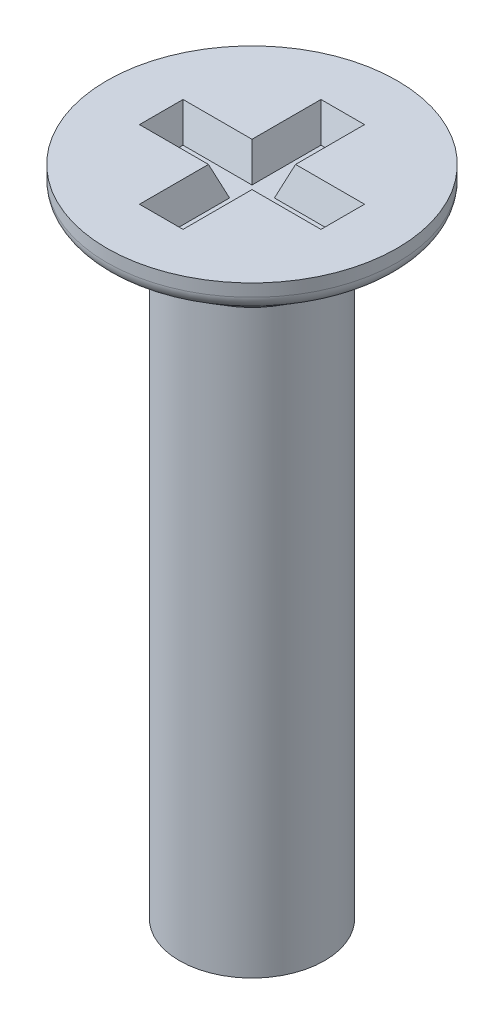
from build123d import *

# Parameters (mm, degrees)
SKETCH1_R           = 1
BOSS_EXTRUDE1_DEPTH = 0.5
CUT_EXTRUDE1_DEPTH  = 0.2
CUT_EXTRUDE1_DRAFT  = -20
SKETCH3_R           = 0.5
BOSS_EXTRUDE2_DEPTH = 4
CHAMFER1_SIZE       = 0.363271264
CHAMFER1_SIZE_2     = 0.5
FILLET1_R           = 0.1


with BuildPart() as part:
    # Sketch1 → Boss-Extrude1 (new body)
    with BuildSketch(Plane(origin=(0, 0, 0), x_dir=(1, 0, 0), z_dir=(0, 1, 0))):
        with Locations(Location((0, 0, 0), (0, 0, 270))):
            Circle(SKETCH1_R)
    extrude(amount=BOSS_EXTRUDE1_DEPTH)


with BuildPart() as cut_extrude1_tool:
    # Sketch2 → Cut-Extrude1 (with draft: the straight prism first)
    with BuildSketch(Plane(origin=(0, 0.5, 0), x_dir=(1, 0, 0), z_dir=(0, 1, 0))):
        Polygon((-0.15, 0.625), (-0.15, 0.15), (-0.625, 0.15), (-0.625, -0.15), (-0.15, -0.15), (-0.15, -0.625), (0.15, -0.625), (0.15, -0.15), (0.625, -0.15), (0.625, 0.15), (0.15, 0.15), (0.15, 0.625), align=None)
    extrude(amount=-CUT_EXTRUDE1_DEPTH)
    # Cut-Extrude1: the draft: its side faces are tilted about the plane it starts from
    cut_extrude1_sides = [cut_extrude1_tool.faces().sort_by_distance(p)[0] for p in [
        (-0.15, 0.4, -0.3875),
        (-0.3875, 0.4, -0.15),
        (-0.625, 0.4, 0),
        (-0.3875, 0.4, 0.15),
        (-0.15, 0.4, 0.3875),
        (0, 0.4, 0.625),
        (0.15, 0.4, 0.3875),
        (0.3875, 0.4, 0.15),
        (0.625, 0.4, 0),
        (0.3875, 0.4, -0.15),
        (0.15, 0.4, -0.3875),
        (0, 0.4, -0.625),
    ]]
    draft(cut_extrude1_sides, Plane(origin=(0, 0.5, 0), x_dir=(1, 0, 0), z_dir=(0, 1, 0)), CUT_EXTRUDE1_DRAFT)


with BuildPart() as part_1:
    add(part.part)

    # Cut-Extrude1: cut by cut_extrude1_tool
    add(cut_extrude1_tool.part, mode=Mode.SUBTRACT)

    # Sketch3 → Boss-Extrude2 (add)
    with BuildSketch(Plane.XZ):
        with Locations(Location((0, 0, 0), (0, 0, 90))):
            Circle(SKETCH3_R)
    extrude(amount=BOSS_EXTRUDE2_DEPTH)

    # Chamfer1
    # the kernel refuses this chamfer: 0.5, 0.363271264 mm, written as the material it takes off along each edge
    with BuildSketch(Plane(origin=(0, 0, 0), x_dir=(0, 0, 1), z_dir=(-1, 0, 0))) as chamfer1_piece_1_section:
        Polygon((1, CHAMFER1_SIZE), (1 - CHAMFER1_SIZE_2, 0), (1, 0), align=None)
    chamfer1_piece_1 = revolve(axis=Axis((0, 0, 0), (0, 1, 0)), mode=Mode.PRIVATE)
    chamfer1_piece_1 = chamfer1_piece_1 - Plane(origin=(0, 0.180960424, 0), x_dir=(0, 0, 1), z_dir=(0, 1, 0)) * Cylinder(0.5, 4, mode=Mode.PRIVATE)
    add(chamfer1_piece_1, mode=Mode.SUBTRACT)

    # Fillet1
    fillet1_edges = [part_1.edges().sort_by_distance(p)[0] for p in [
        (0, 0.363271264, -1),
    ]]
    fillet(fillet1_edges, radius=FILLET1_R)


solid = part_1.part
